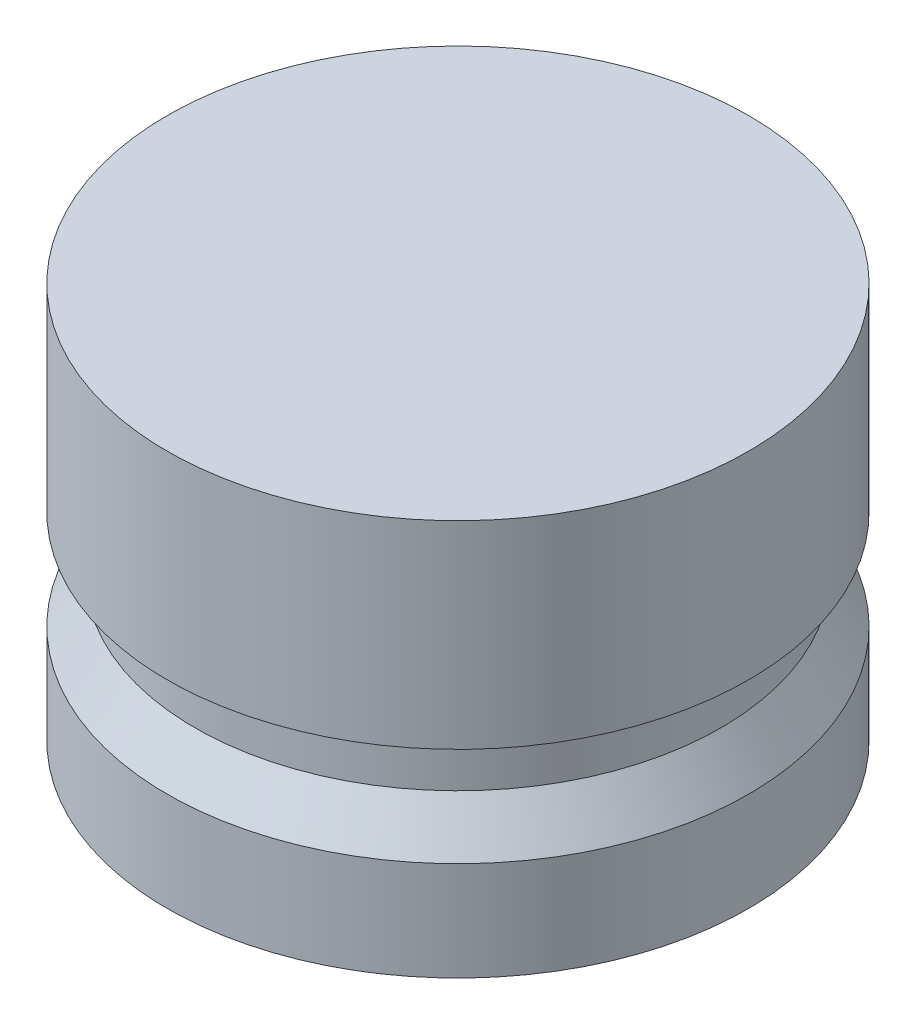
from build123d import *


with BuildPart() as part:
    # Sketch1 → Revolve1 (revolve)
    with BuildSketch(Plane.XY):
        Polygon((0, 0), (-9.3218, 0), (-9.3218, 3.175), (-8.4328, 4.572), (-8.4328, 6.35), (-9.3218, 6.35), (-9.3218, 12.7), (0, 12.7), align=None)
    revolve(axis=Axis((0, 0, 0), (0, 1, 0)))


solid = part.part
